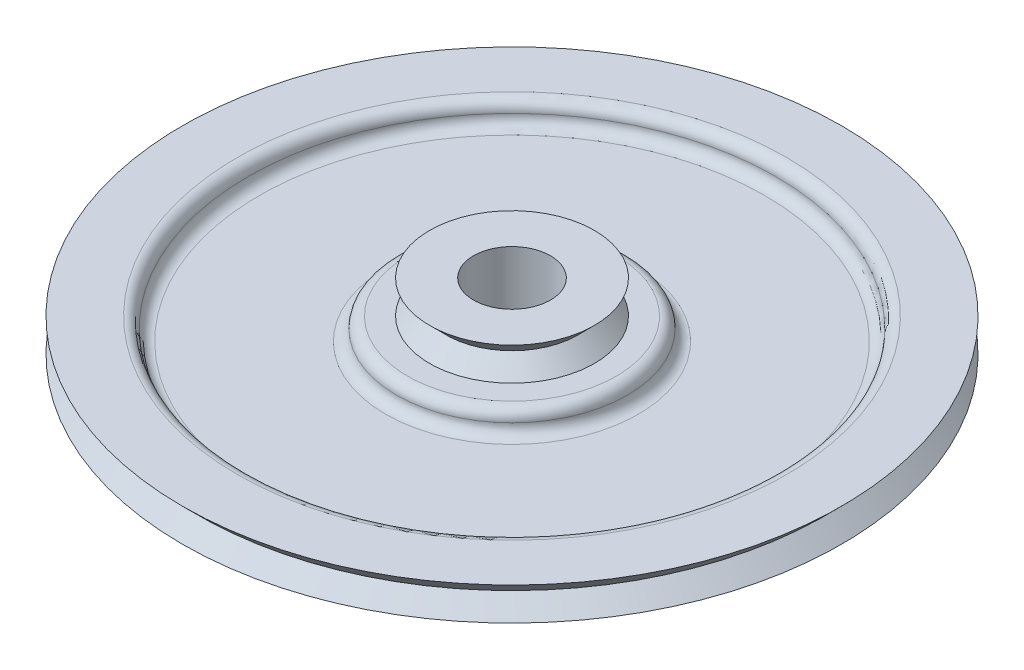
from build123d import *

# Parameters (mm, degrees)
SKETCH2_R          = 24
SKETCH2_R_2        = 10.5
CUT_EXTRUDE1_DEPTH = 2
FILLET1_R          = 1


with BuildPart() as part:
    # Sketch1 → Revolve1 (revolve)
    with BuildSketch(Plane.XY, mode=Mode.PRIVATE) as revolve1_sk:
        Polygon((-3.5, 6), (-3.5, 0), (-30, 0), (-28.5, 1.5), (-30, 3), (-7.5, 3), (-6, 4.5), (-7.5, 6), align=None)
    revolve(revolve1_sk.sketch.rotate(Axis((0, 0, 0), (0, 1, 0)), 270), axis=Axis((0, 0, 0), (0, 1, 0)))

    # Sketch2 → Cut-Extrude1 (cut)
    with BuildSketch(Plane(origin=(0, 3, 0), x_dir=(1, 0, 0), z_dir=(0, 1, 0))):
        with Locations(Location((0, 0, 0), (0, 0, 270))):
            Circle(SKETCH2_R)
        with Locations(Location((0, 0, 0), (0, 0, 270))):
            Circle(SKETCH2_R_2, mode=Mode.SUBTRACT)
    extrude(amount=-CUT_EXTRUDE1_DEPTH, mode=Mode.SUBTRACT)

    # Fillet1
    fillet1_edges = [part.edges().sort_by_distance(p)[0] for p in [
        (0, 1, -10.5),
        (0, 1, -24),
    ]]
    fillet(fillet1_edges, radius=FILLET1_R)
    fillet1_2_edges = [part.edges().sort_by_distance(p)[0] for p in [
        (0, 3, -24),
        (0, 3, -10.5),
    ]]
    fillet(fillet1_2_edges, radius=FILLET1_R - 0.0001)  # a hair under: the kernel refuses the full size


solid = part.part
